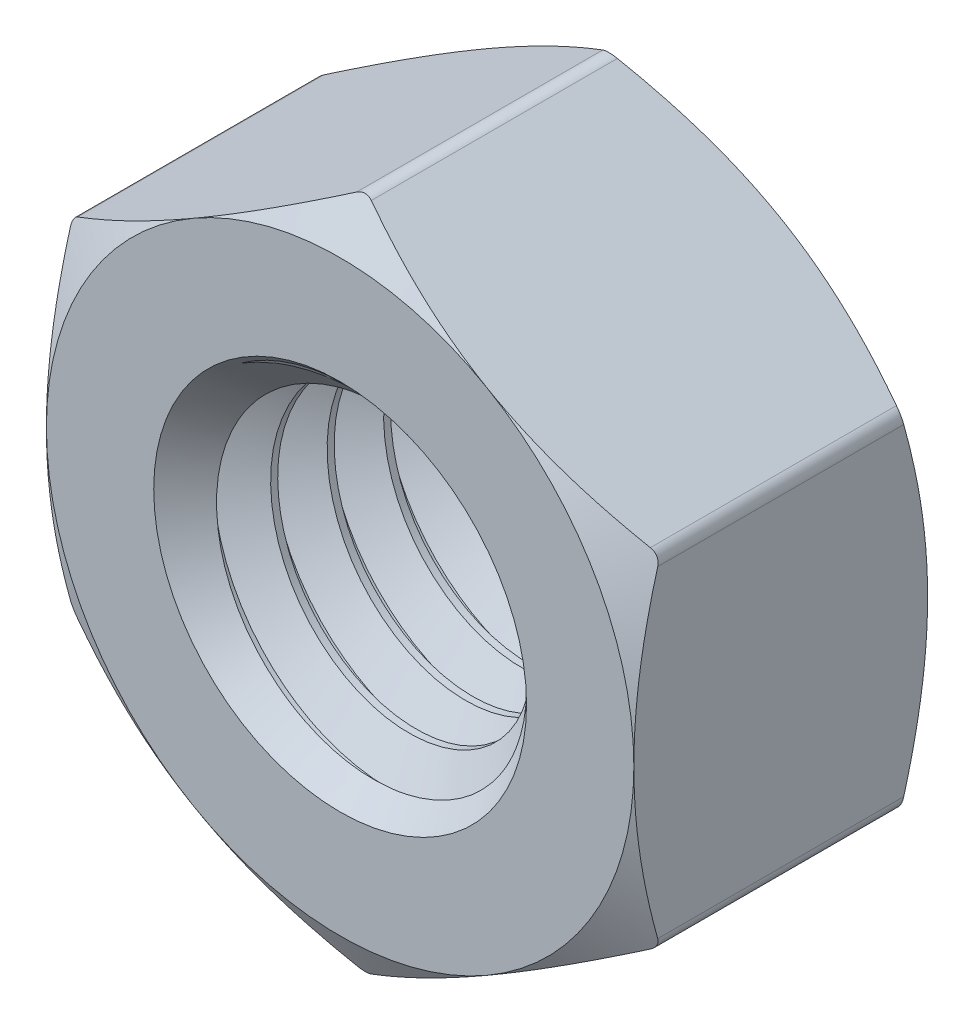
from build123d import *

# Parameters (mm, degrees)
BOSS_EXTRUDE2_DEPTH     = 3.25
CUT_EXTRUDE4_DEPTH      = 11.447288324
CUT_EXTRUDE4_DEPTH_BACK = 11.447288324
SKETCH16_R              = 4
SKETCH7_OUTSIDE_W       = 63.752
SKETCH7_OUTSIDE_H       = 65.764
SKETCH7_OUTSIDE_R       = 6.5
CUT_EXTRUDE5_DEPTH      = 12.867322079
CUT_EXTRUDE5_DRAFT      = -60
MIRROR4_COPY_1_SKETCH_W = 63.752
MIRROR4_COPY_1_SKETCH_H = 65.764
MIRROR4_COPY_1_SKETCH_R = 6.5
MIRROR4_COPY_1_DEPTH    = 12.867322079
MIRROR4_COPY_1_DRAFT    = -60
FILLET2_R               = 0.325
SKETCH13_R              = 4
BOSS_EXTRUDE1_DEPTH     = 6.5
CUT_SWEEP1_PITCH        = 1.25
SKETCH17_R              = 4
BOSS_EXTRUDE3_DEPTH     = 6.5


with BuildPart() as part:
    # Sketch15 → Boss-Extrude2 (new, symmetric)
    with BuildSketch(Plane.XY):
        Polygon((0, 7.505553499), (-6.5, 3.75277675), (-6.5, -3.75277675), (0, -7.505553499), (6.5, -3.75277675), (6.5, 3.75277675), align=None)
    extrude(amount=BOSS_EXTRUDE2_DEPTH, both=True)

    # Sketch16 → Cut-Extrude4 (cut, two sides: drawn at the far end of the back side and taken through both)
    with BuildSketch(Plane.XY.offset(-CUT_EXTRUDE4_DEPTH_BACK)):
        Circle(SKETCH16_R)
    extrude(amount=CUT_EXTRUDE4_DEPTH + CUT_EXTRUDE4_DEPTH_BACK, mode=Mode.SUBTRACT)


with BuildPart() as cut_extrude5_tool:
    # Sketch7 outside → Cut-Extrude5 (with draft: the straight prism first)
    with BuildSketch(Plane.XY.offset(3.25)):
        Rectangle(SKETCH7_OUTSIDE_W, SKETCH7_OUTSIDE_H)
        Circle(SKETCH7_OUTSIDE_R, mode=Mode.SUBTRACT)
    extrude(amount=-CUT_EXTRUDE5_DEPTH)
    # Cut-Extrude5: the draft: its side faces are tilted about the plane it starts from
    cut_extrude5_sides = [cut_extrude5_tool.faces().sort_by_distance(p)[0] for p in [
        (0, -32.882, -3.18366104),
        (31.876, 0, -3.18366104),
        (0, 32.882, -3.18366104),
        (-31.876, 0, -3.18366104),
        (-6.5, 0, -3.18366104),
    ]]
    draft(cut_extrude5_sides, Plane.XY.offset(3.25), CUT_EXTRUDE5_DRAFT)


with BuildPart() as part_1:
    add(part.part)

    # Cut-Extrude5: cut by cut_extrude5_tool
    add(cut_extrude5_tool.part, mode=Mode.SUBTRACT)


with BuildPart() as mirror4_copy_1_tool:
    # Mirror4 copy 1 sketch → Mirror4 copy 1 (with draft: the straight prism first)
    with BuildSketch(Plane(origin=(0, 0, -3.25), x_dir=(1, 0, 0), z_dir=(0, 0, -1))):
        Rectangle(MIRROR4_COPY_1_SKETCH_W, MIRROR4_COPY_1_SKETCH_H)
        Circle(MIRROR4_COPY_1_SKETCH_R, mode=Mode.SUBTRACT)
    extrude(amount=-MIRROR4_COPY_1_DEPTH)
    # Mirror4 copy 1: the draft: its side faces are tilted about the plane it starts from
    mirror4_copy_1_sides = [mirror4_copy_1_tool.faces().sort_by_distance(p)[0] for p in [
        (0, -32.882, 3.18366104),
        (31.876, 0, 3.18366104),
        (0, 32.882, 3.18366104),
        (-31.876, 0, 3.18366104),
        (-6.5, 0, 3.18366104),
    ]]
    draft(mirror4_copy_1_sides, Plane(origin=(0, 0, -3.25), x_dir=(1, 0, 0), z_dir=(0, 0, -1)), MIRROR4_COPY_1_DRAFT)


with BuildPart() as part_2:
    add(part_1.part)

    # Mirror4 copy 1: cut by mirror4_copy_1_tool
    add(mirror4_copy_1_tool.part, mode=Mode.SUBTRACT)

    # Fillet2
    fillet2_edges = [part_2.edges().sort_by_distance(p)[0] for p in [
        (-6.5, 3.75277675, 0),
        (-6.5, -3.75277675, 0),
        (0, -7.505553499, 0),
        (6.5, -3.75277675, 0),
        (6.5, 3.75277675, 0),
        (0, 7.505553499, 0),
    ]]
    fillet(fillet2_edges, radius=FILLET2_R)

    # Sketch17 → Boss-Extrude3 (add)
    with BuildSketch(Plane.XY.offset(3.25)):
        Circle(SKETCH17_R)
    extrude(amount=-BOSS_EXTRUDE3_DEPTH)


with BuildPart() as body_2:
    # Sketch13 → Boss-Extrude1 (new body)
    with BuildSketch(Plane(origin=(0, 0, -3.25), x_dir=(-1, 0, 0), z_dir=(0, 0, -1))):
        Circle(SKETCH13_R)
    extrude(amount=-BOSS_EXTRUDE1_DEPTH)

    # Cut-Sweep1: the profile of Sketch12 profile screwed along a right-hand helix of 7.2 turns, 8 arcs to a turn; built about Z, then put on its axis
    cut_sweep1_z = Axis((0, 0, 0), (0, 0, 1))
    cut_sweep1_corners = [(4.0003, 0, -1.093923205), (4.0003, 0, 0.000173205), (3.188101184, 0, -0.46875), (3.188101184, 0, -0.625)]
    with BuildLine(mode=Mode.PRIVATE) as cut_sweep1_profile:
        Line(cut_sweep1_corners[0], cut_sweep1_corners[1])
        Line(cut_sweep1_corners[1], cut_sweep1_corners[2])
        Line(cut_sweep1_corners[2], cut_sweep1_corners[3])
        Line(cut_sweep1_corners[3], cut_sweep1_corners[0])
    cut_sweep1_cap = Face(cut_sweep1_profile.wire())
    cut_sweep1_turn_angles = [0, 22.5, 45, 67.5, 90, 112.5, 135, 157.5, 180, 202.5, 225, 247.5, 270, 292.5, 315, 337.5, 360]
    cut_sweep1_turn_weights = [1, 0.9238795325112867, 1, 0.9238795325112867, 1, 0.9238795325112867, 1, 0.9238795325112867, 1, 0.9238795325112867, 1, 0.9238795325112867, 1, 0.9238795325112867, 1, 0.9238795325112867, 1]
    cut_sweep1_turn_rails = [Edge.make_bspline([Vector(p[0], p[1], 0).rotate(cut_sweep1_z, cut_sweep1_turn_angles[k]) / cut_sweep1_turn_weights[k] + Vector(0, 0, p[2] + CUT_SWEEP1_PITCH * cut_sweep1_turn_angles[k] / 360) for k in range(17)], [0, 0, 0, 1, 1, 2, 2, 3, 3, 4, 4, 5, 5, 6, 6, 7, 7, 8, 8, 8], 2, cut_sweep1_turn_weights) for p in cut_sweep1_corners]
    cut_sweep1_turn_sides = [Face.make_surface_from_curves(cut_sweep1_turn_rails[p[0]], cut_sweep1_turn_rails[p[1]]) for p in [(0, 1), (1, 2), (2, 3), (3, 0)]]
    cut_sweep1_last_angles = [2520, 2542.5, 2565, 2578.5, 2592]
    cut_sweep1_last_weights = [1, 0.9238795325112867, 1, 0.9723699203976766, 1]
    cut_sweep1_last_rails = [Edge.make_bspline([Vector(p[0], p[1], 0).rotate(cut_sweep1_z, cut_sweep1_last_angles[k]) / cut_sweep1_last_weights[k] + Vector(0, 0, p[2] + CUT_SWEEP1_PITCH * cut_sweep1_last_angles[k] / 360) for k in range(5)], [0, 0, 0, 1, 1, 2, 2, 2], 2, cut_sweep1_last_weights) for p in cut_sweep1_corners]
    cut_sweep1_last_sides = [Face.make_surface_from_curves(cut_sweep1_last_rails[p[0]], cut_sweep1_last_rails[p[1]]) for p in [(0, 1), (1, 2), (2, 3), (3, 0)]]
    cut_sweep1 = Plane(origin=(0, 0, -3.25), x_dir=(0, 1, 0), z_dir=(0, 0, 1)) * Solid(Shell([*[p.moved(Location((0, 0, CUT_SWEEP1_PITCH * i))) for i in range(7) for p in cut_sweep1_turn_sides], *cut_sweep1_last_sides, cut_sweep1_cap, cut_sweep1_cap.rotate(cut_sweep1_z, 2592).moved(Location((0, 0, CUT_SWEEP1_PITCH * 2592 / 360)))]))
    add(cut_sweep1, mode=Mode.SUBTRACT)


with BuildPart() as part_3:
    add(part_2.part)

    # Combine1: cut body 2
    add(body_2.part, mode=Mode.SUBTRACT)

    # Cut-Extrude2 cone 1 section (through the dimple's axis) → Cut-Extrude2 (revolve, cut)
    with BuildSketch(Plane(origin=(0, 0, 3.25), x_dir=(0, -1, 0), z_dir=(1, 0, 0))):
        Polygon((0, 0), (4.125, 0), (0, 4.125), align=None)
    revolve(axis=Axis((0, 0, 3.25), (0, 0, -1)), mode=Mode.SUBTRACT)

    # Cut-Extrude3 cone 1 section (through the dimple's axis) → Cut-Extrude3 (revolve, cut)
    with BuildSketch(Plane(origin=(0, 0, -3.25), x_dir=(0, 1, 0), z_dir=(1, 0, 0))):
        Polygon((0, 0), (4.125, 0), (0, 4.125), align=None)
    revolve(axis=Axis((0, 0, -3.25), (0, 0, 1)), mode=Mode.SUBTRACT)


solid = part_3.part
